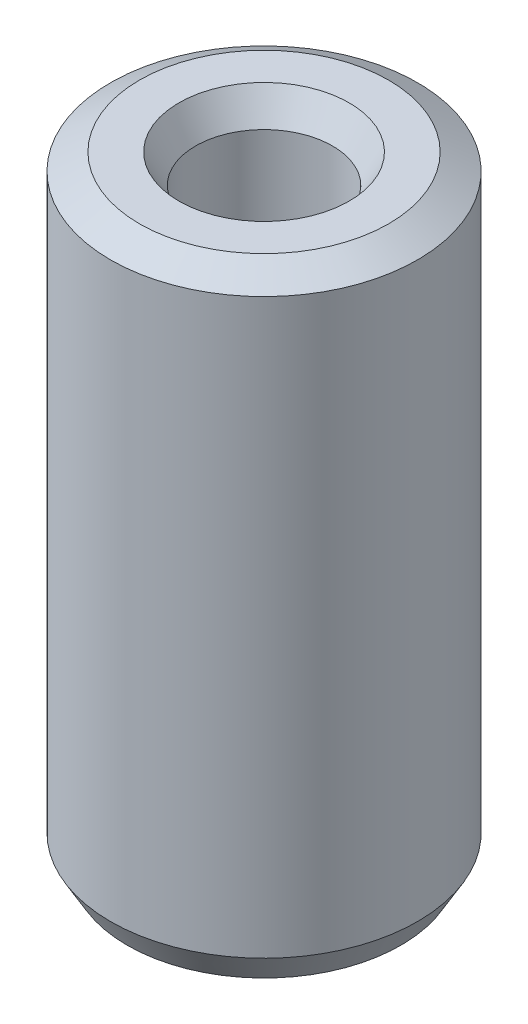
from build123d import *
from OCP.BRepFilletAPI import BRepFilletAPI_MakeChamfer

# Parameters (mm, degrees)
SKETCH1_R           = 22.5
BOSS_EXTRUDE1_DEPTH = 90.688576349
SKETCH2_R           = 10.031325824
CUT_EXTRUDE1_DEPTH  = 97.108885542
CHAMFER1_SIZE       = 2.450771172
CHAMFER1_SIZE2      = 4.244860187


with BuildPart() as part:
    # Sketch1 → Boss-Extrude1 (new body)
    with BuildSketch(Plane(origin=(0, 0, 0), x_dir=(1, 0, 0), z_dir=(0, 1, 0))):
        Circle(SKETCH1_R)
    extrude(amount=BOSS_EXTRUDE1_DEPTH)

    # Sketch2 → Cut-Extrude1 (cut, through all)
    with BuildSketch(Plane(origin=(0, 0, 0), x_dir=(1, 0, 0), z_dir=(0, 1, 0))):
        Circle(SKETCH2_R)
    extrude(amount=CUT_EXTRUDE1_DEPTH, mode=Mode.SUBTRACT)

    # Chamfer1: one chamfer whose edges measure the first distance from different faces: ONE call of the kernel's chamfer builder (chamfer() names one face for all edges)
    chamfer1_edges_1 = [part.edges().sort_by_distance(p)[0] for p in [
        (-10.031325824, 90.688576349, 0),
    ]]
    chamfer1_side_1 = [part.faces().sort_by_distance(p)[0] for p in [
        (-21.863603897, 90.688576349, 0),
    ]]
    chamfer1_edges_2 = [part.edges().sort_by_distance(p)[0] for p in [
        (-10.031325824, 0, 0),
    ]]
    chamfer1_side_2 = [part.faces().sort_by_distance(p)[0] for p in [
        (-10.031325824, 45.344288174, 0),
    ]]
    chamfer1_edges_3 = [part.edges().sort_by_distance(p)[0] for p in [
        (-22.5, 0, 0),
    ]]
    chamfer1_side_3 = [part.faces().sort_by_distance(p)[0] for p in [
        (-21.863603897, 0, 0),
    ]]
    chamfer1_edges_4 = [part.edges().sort_by_distance(p)[0] for p in [
        (-22.5, 90.688576349, 0),
    ]]
    chamfer1_side_4 = [part.faces().sort_by_distance(p)[0] for p in [
        (-22.5, 45.344288174, 0),
    ]]
    chamfer1 = BRepFilletAPI_MakeChamfer(part.part.solid().wrapped)
    for e in chamfer1_edges_1:
        chamfer1.Add(CHAMFER1_SIZE, CHAMFER1_SIZE2, e.wrapped, chamfer1_side_1[0].wrapped)  # the first distance lies on this face
    for e in chamfer1_edges_2:
        chamfer1.Add(CHAMFER1_SIZE, CHAMFER1_SIZE2, e.wrapped, chamfer1_side_2[0].wrapped)  # the first distance lies on this face
    for e in chamfer1_edges_3:
        chamfer1.Add(CHAMFER1_SIZE, CHAMFER1_SIZE2, e.wrapped, chamfer1_side_3[0].wrapped)  # the first distance lies on this face
    for e in chamfer1_edges_4:
        chamfer1.Add(CHAMFER1_SIZE, CHAMFER1_SIZE2, e.wrapped, chamfer1_side_4[0].wrapped)  # the first distance lies on this face
    add(Compound.cast(chamfer1.Shape()), mode=Mode.REPLACE)


solid = part.part
